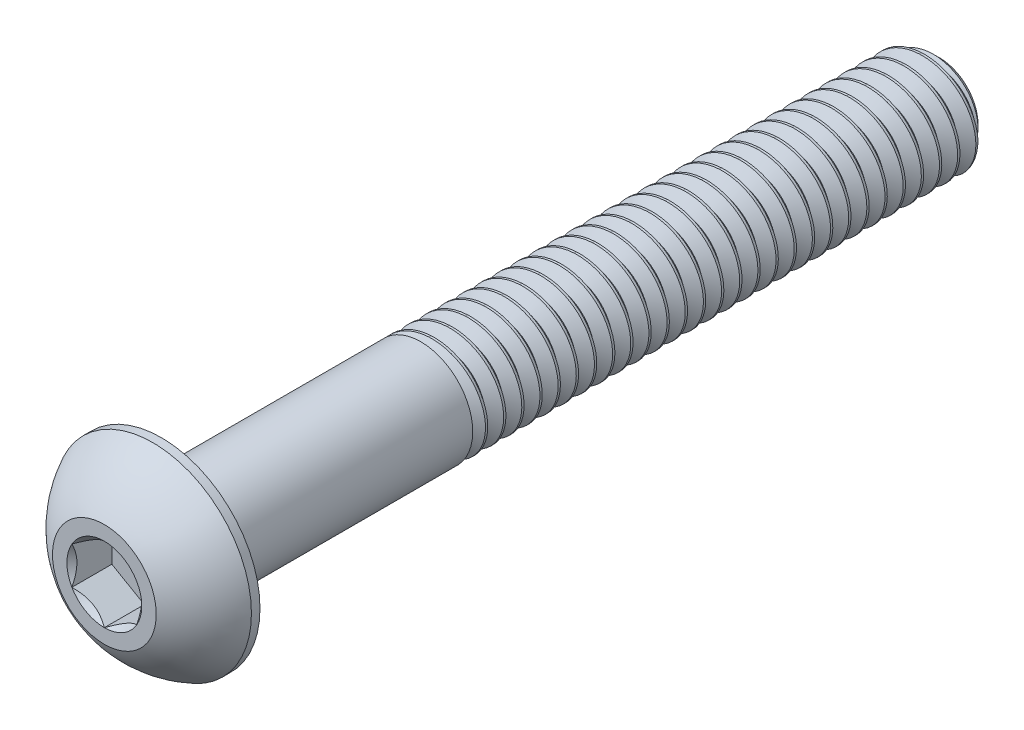
from build123d import *
from build123d.topology import SkipClean

# Parameters (mm, degrees)
SKETCH1_W           = 30
SKETCH1_H           = 2
CHAMFER1_SIZE       = 0.525
CUT_SWEEP1_PITCH    = 0.7
CUT_EXTRUDE2_DEPTH  = 1.54
BOSS_EXTRUDE2_START = -10
SKETCH9_R           = 2
BOSS_EXTRUDE2_DEPTH = 10


with BuildPart() as part:
    # Sketch1 → Revolve1 (revolve)
    with BuildSketch(Plane(origin=(0, 0, 0), x_dir=(0, 0, -1), z_dir=(1, 0, 0))):
        with Locations((17.2, 1)):
            Rectangle(SKETCH1_W, SKETCH1_H)
    revolve(axis=Axis((0, 0, -32.2), (0, 0, 1)))

    # Chamfer1
    chamfer1_edges = [part.edges().sort_by_distance(p)[0] for p in [
        (0, -2, -32.2),
    ]]
    chamfer(chamfer1_edges, length=CHAMFER1_SIZE)

    # Cut-Sweep1: the profile of Sketch2 profile screwed along a right-hand helix of 43.857143 turns, 6 arcs to a turn; built about Z, then put on its axis
    cut_sweep1_z = Axis((0, 0, 0), (0, 0, 1))
    cut_sweep1_corners = [(2.0003, 0, 0.000173205), (2.0003, 0, -0.612673205), (1.545336663, 0, -0.35), (1.545336663, 0, -0.2625)]
    with BuildLine(mode=Mode.PRIVATE) as cut_sweep1_profile:
        Line(cut_sweep1_corners[0], cut_sweep1_corners[1])
        Line(cut_sweep1_corners[1], cut_sweep1_corners[2])
        Line(cut_sweep1_corners[2], cut_sweep1_corners[3])
        Line(cut_sweep1_corners[3], cut_sweep1_corners[0])
    cut_sweep1_cap = Face(cut_sweep1_profile.wire())
    cut_sweep1_turn_angles = [0, 30, 60, 90, 120, 150, 180, 210, 240, 270, 300, 330, 360, 390, 420, 450, 480, 510, 540, 570, 600, 630, 660, 690, 720]
    cut_sweep1_turn_weights = [1, 0.8660254037844387, 1, 0.8660254037844387, 1, 0.8660254037844387, 1, 0.8660254037844387, 1, 0.8660254037844387, 1, 0.8660254037844387, 1, 0.8660254037844387, 1, 0.8660254037844387, 1, 0.8660254037844387, 1, 0.8660254037844387, 1, 0.8660254037844387, 1, 0.8660254037844387, 1]
    cut_sweep1_turn_rails = [Edge.make_bspline([Vector(p[0], p[1], 0).rotate(cut_sweep1_z, cut_sweep1_turn_angles[k]) / cut_sweep1_turn_weights[k] + Vector(0, 0, p[2] + CUT_SWEEP1_PITCH * cut_sweep1_turn_angles[k] / 360) for k in range(25)], [0, 0, 0, 1, 1, 2, 2, 3, 3, 4, 4, 5, 5, 6, 6, 7, 7, 8, 8, 9, 9, 10, 10, 11, 11, 12, 12, 12], 2, cut_sweep1_turn_weights) for p in cut_sweep1_corners]
    cut_sweep1_turn_sides = [Face.make_surface_from_curves(cut_sweep1_turn_rails[p[0]], cut_sweep1_turn_rails[p[1]]) for p in [(0, 1), (1, 2), (2, 3), (3, 0)]]
    cut_sweep1_last_angles = [15120, 15150, 15180, 15210, 15240, 15270, 15300, 15330, 15360, 15390, 15420, 15450, 15480, 15510, 15540, 15570, 15600, 15630, 15660, 15690, 15720, 15750, 15780, 15784.285714286, 15788.571428571]
    cut_sweep1_last_weights = [1, 0.8660254037844387, 1, 0.8660254037844387, 1, 0.8660254037844387, 1, 0.8660254037844387, 1, 0.8660254037844387, 1, 0.8660254037844387, 1, 0.8660254037844387, 1, 0.8660254037844387, 1, 0.8660254037844387, 1, 0.8660254037844387, 1, 0.8660254037844387, 1, 0.9972037971813268, 1]
    cut_sweep1_last_rails = [Edge.make_bspline([Vector(p[0], p[1], 0).rotate(cut_sweep1_z, cut_sweep1_last_angles[k]) / cut_sweep1_last_weights[k] + Vector(0, 0, p[2] + CUT_SWEEP1_PITCH * cut_sweep1_last_angles[k] / 360) for k in range(25)], [0, 0, 0, 1, 1, 2, 2, 3, 3, 4, 4, 5, 5, 6, 6, 7, 7, 8, 8, 9, 9, 10, 10, 11, 11, 12, 12, 12], 2, cut_sweep1_last_weights) for p in cut_sweep1_corners]
    cut_sweep1_last_sides = [Face.make_surface_from_curves(cut_sweep1_last_rails[p[0]], cut_sweep1_last_rails[p[1]]) for p in [(0, 1), (1, 2), (2, 3), (3, 0)]]
    cut_sweep1 = Plane(origin=(0, 0, -32.2), x_dir=(0, 1, 0), z_dir=(0, 0, 1)) * Solid(Shell([*[p.moved(Location((0, 0, 2 * CUT_SWEEP1_PITCH * i))) for i in range(21) for p in cut_sweep1_turn_sides], *cut_sweep1_last_sides, cut_sweep1_cap, cut_sweep1_cap.rotate(cut_sweep1_z, 15788.571428571).moved(Location((0, 0, CUT_SWEEP1_PITCH * 15788.571428571 / 360)))]))
    add(cut_sweep1, mode=Mode.SUBTRACT)

    # Sketch7 → Revolve2 (revolve)
    with BuildSketch(Plane(origin=(0, 0, 0), x_dir=(0, 0, -1), z_dir=(1, 0, 0))):
        with BuildLine():
            Line((1.87, 3.8), (2.2, 3.8))
            Line((2.2, 3.8), (2.2, 0))
            Line((2.2, 0), (0, 0))
            Line((0, 0), (0, 2))
            ThreePointArc((0, 2), (0.793500147, 3.047002626), (1.87, 3.8))
        make_face()
    revolve(axis=Axis((0, 0, 0), (0, 0, -1)))

    # Sketch5 → Cut-Extrude2 (cut)
    with BuildSketch(Plane.XY):
        Polygon((1.25, -0.721687836), (1.25, 0.721687836), (0, 1.443375673), (-1.25, 0.721687836), (-1.25, -0.721687836), (0, -1.443375673), align=None)
    extrude(amount=-CUT_EXTRUDE2_DEPTH, mode=Mode.SUBTRACT)

    # Cut-Extrude3 cone 1 section (through the dimple's axis) → Cut-Extrude3 (revolve, cut)
    with BuildSketch(Plane(origin=(0, 0, 0), x_dir=(0, -1, 0), z_dir=(1, 0, 0))):
        Polygon((0, 0), (1.443375673, 0), (0, 1.443375673), align=None)
    revolve(axis=Axis((0, 0, 0), (0, 0, -1)), mode=Mode.SUBTRACT)

    # Sketch9 → Boss-Extrude2 (add)
    with SkipClean():  # the faces are left unmerged after this step: merging them gives an invalid solid
        with BuildSketch(Plane.XY.offset(-2.2).offset(BOSS_EXTRUDE2_START)):
            with Locations(Location((0, 0, 0), (0, 0, 90))):
                Circle(SKETCH9_R)
        extrude(amount=BOSS_EXTRUDE2_DEPTH)


solid = part.part
